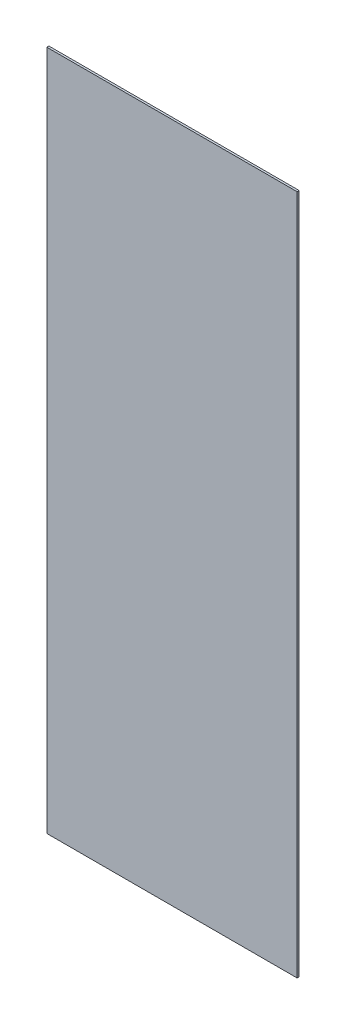
from build123d import *

# Parameters (mm, degrees)
SKETCH2_W          = 147.43176
SKETCH2_H          = 401.072549756
BASE_FLANGE1_DEPTH = 1.21412


# Sheet-metal steps are written as plain solids
with BuildPart() as part:
    # Sketch2 → Base-Flange1 (new body)
    with BuildSketch(Plane.XY):
        with Locations((0, -203.2)):
            Rectangle(SKETCH2_W, SKETCH2_H)
    extrude(amount=BASE_FLANGE1_DEPTH)


solid = part.part
